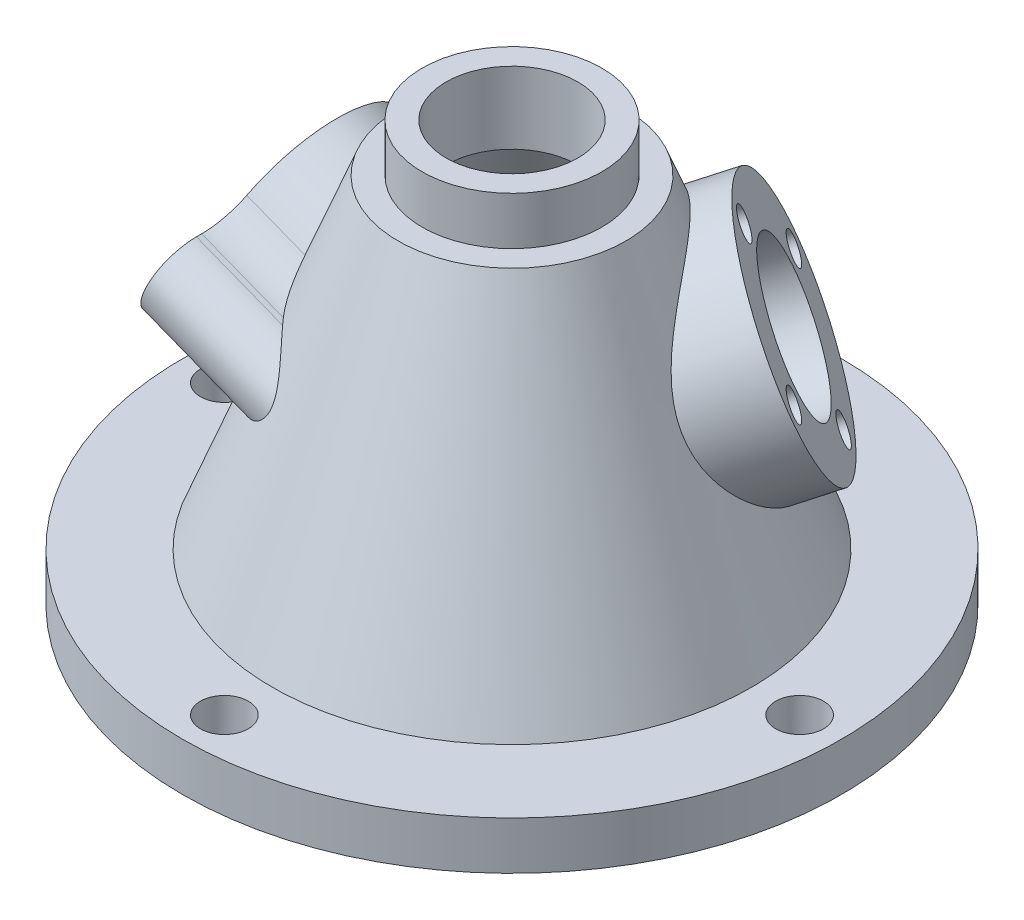
from build123d import *

# Parameters (mm, degrees)
BOSS_EXTRUDE6_REACH = 64.546
CUT_EXTRUDE3_REACH  = 64.546
SKETCH5_10_R        = 7
SKETCH5_10_R_2      = 1.25
BOSS_EXTRUDE8_REACH = 67.765
SKETCH9_R           = 10
CUT_EXTRUDE5_REACH  = 67.765
SKETCH9_5_R         = 6
SKETCH9_5_R_2       = 1.25
SKETCH13_R          = 2
CUT_EXTRUDE7_DEPTH  = 10


with BuildPart() as part:
    # Sketch1 → Revolve1 (revolve)
    with BuildSketch(Plane.XY):
        Polygon((7.5, 35), (7.5, 31), (9.5, 31), (20, 4), (27.5, 4), (27.5, 0), (19.409643565, 0), (8.131865787, 29), (5.5, 29), (5.5, 35), align=None)
    revolve(axis=Axis((0, 0, 0), (0, 1, 0)))

    # Sketch5 → Boss-Extrude6 (add, up to next)
    with BuildSketch(Plane(origin=(-22.093932973, 8.614064511, 0), x_dir=(0, 0, -1), z_dir=(0.9316912275855487, -0.3632512304729791, 0)), mode=Mode.PRIVATE) as boss_extrude6_sk1:
        with BuildLine():
            ThreePointArc((-6.374863833, 7.775859632), (0, 4.609192965), (6.374863833, 7.775859632))
            ThreePointArc((6.374863833, 7.775859632), (7.782782707, 8.941557176), (9.562295749, 9.359192965))
            Line((9.562295749, 9.359192965), (10, 9.359192965))
            ThreePointArc((10, 9.359192965), (13.25, 12.609192965), (10, 15.859192965))
            Line((10, 15.859192965), (9.562295749, 15.859192965))
            ThreePointArc((9.562295749, 15.859192965), (7.782782707, 16.276828755), (6.374863833, 17.442526299))
            ThreePointArc((6.374863833, 17.442526299), (0, 20.609192965), (-6.374863833, 17.442526299))
            ThreePointArc((-6.374863833, 17.442526299), (-7.782782707, 16.276828755), (-9.562295749, 15.859192965))
            Line((-9.562295749, 15.859192965), (-10, 15.859192965))
            ThreePointArc((-10, 15.859192965), (-13.25, 12.609192965), (-10, 9.359192965))
            Line((-10, 9.359192965), (-9.562295749, 9.359192965))
            ThreePointArc((-9.562295749, 9.359192965), (-7.782782707, 8.941557176), (-6.374863833, 7.775859632))
        make_face()
    boss_extrude6_tool1 = extrude(boss_extrude6_sk1.sketch, amount=BOSS_EXTRUDE6_REACH, mode=Mode.PRIVATE) - part.part
    add(boss_extrude6_tool1.solids().sort_by_distance((-17.513628, 20.361939, 0))[0])

    # Sketch5<10> → Cut-Extrude3 (cut, up to next)
    with BuildSketch(Plane(origin=(-22.093932973, 8.614064511, 0), x_dir=(0, 0, -1), z_dir=(0.9316912275855487, -0.3632512304729791, 0)), mode=Mode.PRIVATE) as cut_extrude3_sk1:
        with Locations((0, 12.609192965)):
            Circle(SKETCH5_10_R)
    cut_extrude3_tool1 = extrude(cut_extrude3_sk1.sketch, amount=CUT_EXTRUDE3_REACH, mode=Mode.PRIVATE) & part.part
    # Sketch5<10> → Cut-Extrude3 (cut, up to next)
    with BuildSketch(Plane(origin=(-22.093932973, 8.614064511, 0), x_dir=(0, 0, -1), z_dir=(0.9316912275855487, -0.3632512304729791, 0)), mode=Mode.PRIVATE) as cut_extrude3_sk2:
        with Locations((-10, 12.609192965)):
            Circle(SKETCH5_10_R_2)
    cut_extrude3_tool2 = extrude(cut_extrude3_sk2.sketch, amount=CUT_EXTRUDE3_REACH, mode=Mode.PRIVATE) & part.part
    # Sketch5<10> → Cut-Extrude3 (cut, up to next)
    with BuildSketch(Plane(origin=(-22.093932973, 8.614064511, 0), x_dir=(0, 0, -1), z_dir=(0.9316912275855487, -0.3632512304729791, 0)), mode=Mode.PRIVATE) as cut_extrude3_sk3:
        with Locations((10, 12.609192965)):
            Circle(SKETCH5_10_R_2)
    cut_extrude3_tool3 = extrude(cut_extrude3_sk3.sketch, amount=CUT_EXTRUDE3_REACH, mode=Mode.PRIVATE) & part.part
    add(cut_extrude3_tool1.solids().sort_by_distance((-17.513628, 20.361939, 0))[0], mode=Mode.SUBTRACT)
    add(cut_extrude3_tool2.solids().sort_by_distance((-17.513628, 20.361939, 10))[0], mode=Mode.SUBTRACT)
    add(cut_extrude3_tool3.solids().sort_by_distance((-17.513628, 20.361939, -10))[0], mode=Mode.SUBTRACT)

    # Sketch9 → Boss-Extrude8 (add, up to next)
    with BuildSketch(Plane(origin=(15.018344857, 8.366322489, -15.018344857), x_dir=(-0.7071067811865516, 0, -0.7071067811865436), z_dir=(-0.6579045716551812, -0.36650122672429836, 0.6579045716551886)), mode=Mode.PRIVATE) as boss_extrude8_sk1:
        with Locations((0, -12.564614879)):
            Circle(SKETCH9_R)
    boss_extrude8_tool1 = extrude(boss_extrude8_sk1.sketch, amount=BOSS_EXTRUDE8_REACH, mode=Mode.PRIVATE) - part.part
    add(boss_extrude8_tool1.solids().sort_by_distance((11.762156, 20.056661, -11.762156))[0])

    # Sketch9<5> → Cut-Extrude5 (cut, up to next)
    with BuildSketch(Plane(origin=(15.018344857, 8.366322489, -15.018344857), x_dir=(-0.7071067811865516, 0, -0.7071067811865436), z_dir=(-0.6579045716551812, -0.36650122672429836, 0.6579045716551886)), mode=Mode.PRIVATE) as cut_extrude5_sk1:
        with Locations((0, -12.564614879)):
            Circle(SKETCH9_5_R)
    cut_extrude5_tool1 = extrude(cut_extrude5_sk1.sketch, amount=CUT_EXTRUDE5_REACH, mode=Mode.PRIVATE) & part.part
    # Sketch9<5> → Cut-Extrude5 (cut, up to next)
    with BuildSketch(Plane(origin=(15.018344857, 8.366322489, -15.018344857), x_dir=(-0.7071067811865516, 0, -0.7071067811865436), z_dir=(-0.6579045716551812, -0.36650122672429836, 0.6579045716551886)), mode=Mode.PRIVATE) as cut_extrude5_sk2:
        with Locations((8, -12.564614879)):
            Circle(SKETCH9_5_R_2)
    cut_extrude5_tool2 = extrude(cut_extrude5_sk2.sketch, amount=CUT_EXTRUDE5_REACH, mode=Mode.PRIVATE) & part.part
    # Sketch9<5> → Cut-Extrude5 (cut, up to next)
    with BuildSketch(Plane(origin=(15.018344857, 8.366322489, -15.018344857), x_dir=(-0.7071067811865516, 0, -0.7071067811865436), z_dir=(-0.6579045716551812, -0.36650122672429836, 0.6579045716551886)), mode=Mode.PRIVATE) as cut_extrude5_sk3:
        with Locations((0, -20.564614879)):
            Circle(SKETCH9_5_R_2)
    cut_extrude5_tool3 = extrude(cut_extrude5_sk3.sketch, amount=CUT_EXTRUDE5_REACH, mode=Mode.PRIVATE) & part.part
    # Sketch9<5> → Cut-Extrude5 (cut, up to next)
    with BuildSketch(Plane(origin=(15.018344857, 8.366322489, -15.018344857), x_dir=(-0.7071067811865516, 0, -0.7071067811865436), z_dir=(-0.6579045716551812, -0.36650122672429836, 0.6579045716551886)), mode=Mode.PRIVATE) as cut_extrude5_sk4:
        with Locations((-8, -12.564614879)):
            Circle(SKETCH9_5_R_2)
    cut_extrude5_tool4 = extrude(cut_extrude5_sk4.sketch, amount=CUT_EXTRUDE5_REACH, mode=Mode.PRIVATE) & part.part
    # Sketch9<5> → Cut-Extrude5 (cut, up to next)
    with BuildSketch(Plane(origin=(15.018344857, 8.366322489, -15.018344857), x_dir=(-0.7071067811865516, 0, -0.7071067811865436), z_dir=(-0.6579045716551812, -0.36650122672429836, 0.6579045716551886)), mode=Mode.PRIVATE) as cut_extrude5_sk5:
        with Locations((0, -4.564614879)):
            Circle(SKETCH9_5_R_2)
    cut_extrude5_tool5 = extrude(cut_extrude5_sk5.sketch, amount=CUT_EXTRUDE5_REACH, mode=Mode.PRIVATE) & part.part
    add(cut_extrude5_tool1.solids().sort_by_distance((11.762156, 20.056661, -11.762156))[0], mode=Mode.SUBTRACT)
    add(cut_extrude5_tool2.solids().sort_by_distance((6.105302, 20.056661, -17.41901))[0], mode=Mode.SUBTRACT)
    add(cut_extrude5_tool3.solids().sort_by_distance((9.688912, 27.500001, -9.688912))[0], mode=Mode.SUBTRACT)
    add(cut_extrude5_tool4.solids().sort_by_distance((17.41901, 20.056661, -6.105302))[0], mode=Mode.SUBTRACT)
    add(cut_extrude5_tool5.solids().sort_by_distance((13.8354, 12.61332, -13.8354))[0], mode=Mode.SUBTRACT)

    # Sketch13 → Cut-Extrude7 (cut)
    with BuildSketch(Plane(origin=(0, 0, 0), x_dir=(1, 0, 0), z_dir=(0, 1, 0))):
        with Locations((-24, 0)):
            Circle(SKETCH13_R)
        with Locations((0, 24)):
            Circle(SKETCH13_R)
        with Locations((24, 0)):
            Circle(SKETCH13_R)
        with Locations((0, -24)):
            Circle(SKETCH13_R)
    extrude(amount=CUT_EXTRUDE7_DEPTH, mode=Mode.SUBTRACT)


solid = part.part
